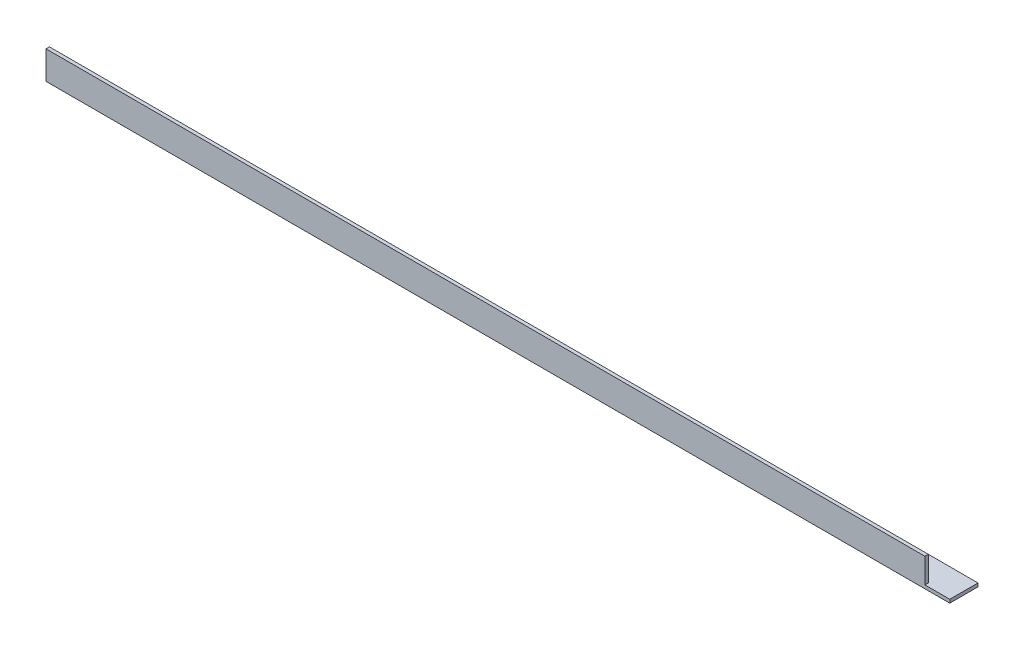
from build123d import *

# Parameters (mm, degrees)
EXTRUDE_1_DEPTH     = 800
CUT_EXTRUDE_1_REACH = 802.781
SKETCH_2_W          = 22
SKETCH_2_H          = 22


with BuildPart() as part:
    # Эскиз1 → Вытянуть-Тонкостенный1 (new body)
    with BuildSketch(Plane(origin=(0, 0, 0), x_dir=(0, 0, -1), z_dir=(1, 0, 0))):
        Polygon((0, 25), (0, 0), (25, 0), (25, 3), (3, 3), (3, 25), align=None)
    extrude(amount=EXTRUDE_1_DEPTH)

    # Эскиз2 → Вырез-Вытянуть1 (cut, up to next)
    with BuildSketch(Plane.XY, mode=Mode.PRIVATE) as cut_extrude_1_sk1:
        with Locations((789, 14)):
            Rectangle(SKETCH_2_W, SKETCH_2_H)
    cut_extrude_1_tool1 = extrude(cut_extrude_1_sk1.sketch, amount=-CUT_EXTRUDE_1_REACH, mode=Mode.PRIVATE) & part.part
    add(cut_extrude_1_tool1.solids().sort_by_distance((789, 14, 0))[0], mode=Mode.SUBTRACT)


solid = part.part
